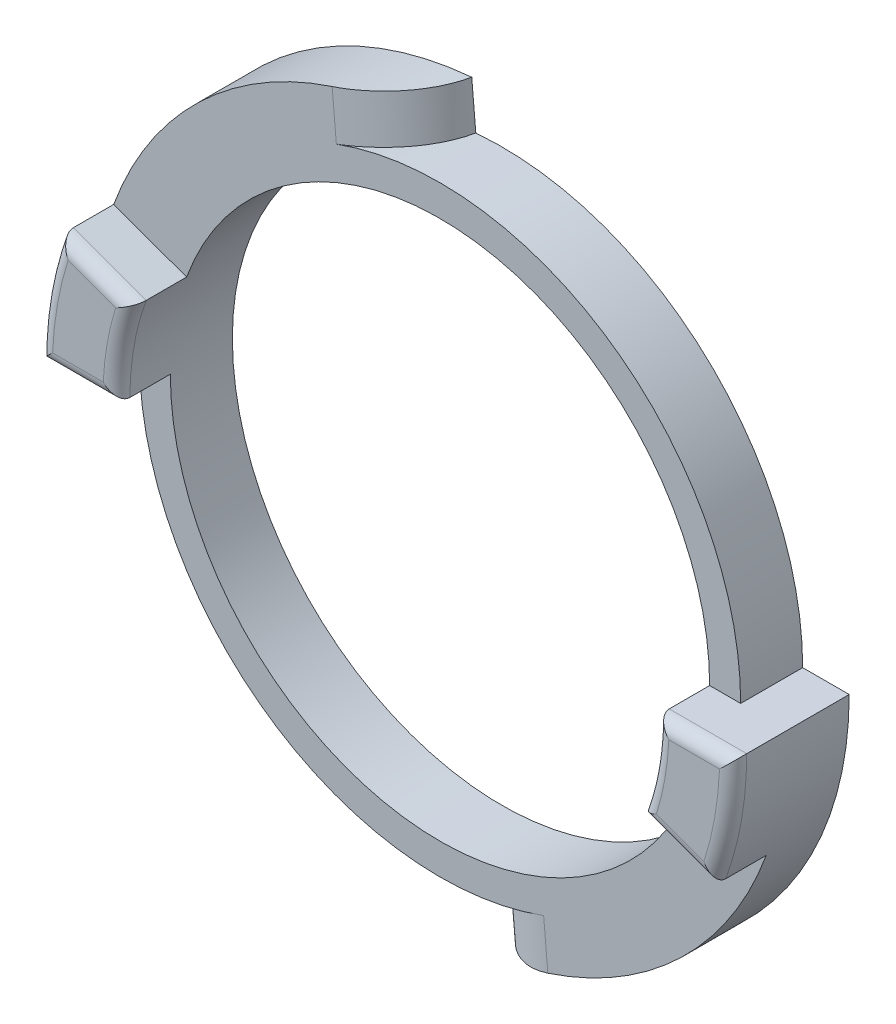
from build123d import *

# Parameters (mm, degrees)
BOSS_EXTRUDE1_DEPTH = 2.3
FILLET1_R           = 3
BOSS_EXTRUDE2_DEPTH = 2
FILLET2_R           = 0.5


with BuildPart() as part:
    # Sketch2 → Boss-Extrude1 (new body)
    with BuildSketch(Plane.XY):
        with BuildLine():
            ThreePointArc((-11.15, 0), (-8.220642305, 7.532830815), (-0.971786532, 11.107570884))
            Line((-0.971786532, 11.107570884), (-1.122130188, 12.826006738))
            ThreePointArc((-1.122130188, 12.826006738), (-9.492445711, 8.698223923), (-12.875, 0))
            Line((-12.875, 0), (-11.15, 0))
        make_face()
        with BuildLine():
            ThreePointArc((-10, 0), (-7.372773368, 6.755902076), (-0.871557427, 9.961946981))
            Line((-0.871557427, 9.961946981), (-0.971786532, 11.107570884))
            ThreePointArc((-0.971786532, 11.107570884), (-8.220642305, 7.532830815), (-11.15, 0))
            Line((-11.15, 0), (-10, 0))
        make_face()
        with BuildLine():
            Line((-0.971786532, 11.107570884), (-0.871557427, 9.961946981))
            ThreePointArc((-0.871557427, 9.961946981), (6.755902076, 7.372773368), (10, 0))
            Line((10, 0), (11.15, 0))
            ThreePointArc((11.15, 0), (10.885700479, 2.413301695), (10.105331825, 4.712193618))
            ThreePointArc((10.105331825, 4.712193618), (5.575, 9.656183252), (-0.971786532, 11.107570884))
        make_face()
        with BuildLine():
            ThreePointArc((10, 0), (7.372773368, -6.755902076), (0.871557427, -9.961946981))
            Line((0.871557427, -9.961946981), (0.971786532, -11.107570884))
            ThreePointArc((0.971786532, -11.107570884), (8.220642305, -7.532830815), (11.15, 0))
            Line((11.15, 0), (10, 0))
        make_face()
        with BuildLine():
            Line((0.971786532, -11.107570884), (0.871557427, -9.961946981))
            ThreePointArc((0.871557427, -9.961946981), (-6.755902076, -7.372773368), (-10, 0))
            Line((-10, 0), (-11.15, 0))
            ThreePointArc((-11.15, 0), (-7.532830815, -8.220642305), (0.971786532, -11.107570884))
        make_face()
        with BuildLine():
            ThreePointArc((11.15, 0), (8.220642305, -7.532830815), (0.971786532, -11.107570884))
            Line((0.971786532, -11.107570884), (1.122130188, -12.826006738))
            ThreePointArc((1.122130188, -12.826006738), (9.492445711, -8.698223923), (12.875, 0))
            Line((12.875, 0), (11.15, 0))
        make_face()
    extrude(amount=BOSS_EXTRUDE1_DEPTH)

    # Fillet1
    # the kernel refuses this fillet: 3 mm, written as the material it takes off along each edge
    with BuildSketch(Plane(origin=(-1.757754934, 20.091230835, 2.3), x_dir=(0, 0, -1), z_dir=(0.08715574274757223, -0.9961946980917531, 0))) as fillet1_piece_1_section:
        with BuildLine():
            CenterArc((3, -2.917190429), FILLET1_R, 103.493398822, 76.506601178)
            Line((0, -2.917190429), (0, 0))
            Line((0, 0), (2.3, 0))
        make_face()
    fillet1_piece_1 = extrude(amount=16.310952146, mode=Mode.PRIVATE)
    fillet1_piece_1 = fillet1_piece_1 - Plane(origin=(0, 0, 1.660555485), x_dir=(1, 0, 0), z_dir=(0, 0, -1)) * Cylinder(11.15, 45, mode=Mode.PRIVATE)
    add(fillet1_piece_1, mode=Mode.SUBTRACT)
    with BuildSketch(Plane(origin=(0.336161785, -3.842346787, 2.3), x_dir=(0.9961946980917454, 0.08715574274765826, 0), z_dir=(0.08715574274765828, -0.9961946980917455, 0))) as fillet1_piece_2_section:
        with BuildLine():
            CenterArc((2.917190429, -3), FILLET1_R, 90, 76.506601178)
            Line((0, -2.3), (0, 0))
            Line((0, 0), (2.917190429, 0))
        make_face()
    fillet1_piece_2 = extrude(amount=16.310952146, mode=Mode.PRIVATE)
    fillet1_piece_2 = fillet1_piece_2 - Plane(origin=(0, 0, 1.660555485), x_dir=(1, 0, 0), z_dir=(0, 0, -1)) * Cylinder(11.15, 45, mode=Mode.PRIVATE)
    add(fillet1_piece_2, mode=Mode.SUBTRACT)

    # Sketch3 → Boss-Extrude2 (add)
    with BuildSketch(Plane.XY.offset(2.3)):
        with BuildLine():
            ThreePointArc((-10, 0), (-9.84807753, 1.736481777), (-9.396926208, 3.420201433))
            Line((-9.396926208, 3.420201433), (-12.098542493, 4.403509345))
            ThreePointArc((-12.098542493, 4.403509345), (-12.67939982, 2.235720287), (-12.875, 0))
            Line((-12.875, 0), (-11.15, 0))
            Line((-11.15, 0), (-10, 0))
        make_face()
        with BuildLine():
            ThreePointArc((10, 0), (9.84807753, -1.736481777), (9.396926208, -3.420201433))
            Line((9.396926208, -3.420201433), (12.098542493, -4.403509345))
            ThreePointArc((12.098542493, -4.403509345), (12.67939982, -2.235720287), (12.875, 0))
            Line((12.875, 0), (11.15, 0))
            Line((11.15, 0), (10, 0))
        make_face()
    extrude(amount=BOSS_EXTRUDE2_DEPTH)

    # Fillet2
    fillet2_edges = [part.edges().sort_by_distance(p)[0] for p in [
        (-11.4375, 0, 4.3),
        (-9.84807753, 1.736481777, 4.3),
        (-10.74773435, 3.911855389, 4.3),
        (-12.67939982, 2.235720287, 4.3),
        (11.4375, 0, 4.3),
        (9.84807753, -1.736481777, 4.3),
        (10.74773435, -3.911855389, 4.3),
        (12.67939982, -2.235720287, 4.3),
    ]]
    fillet(fillet2_edges, radius=FILLET2_R)


solid = part.part
